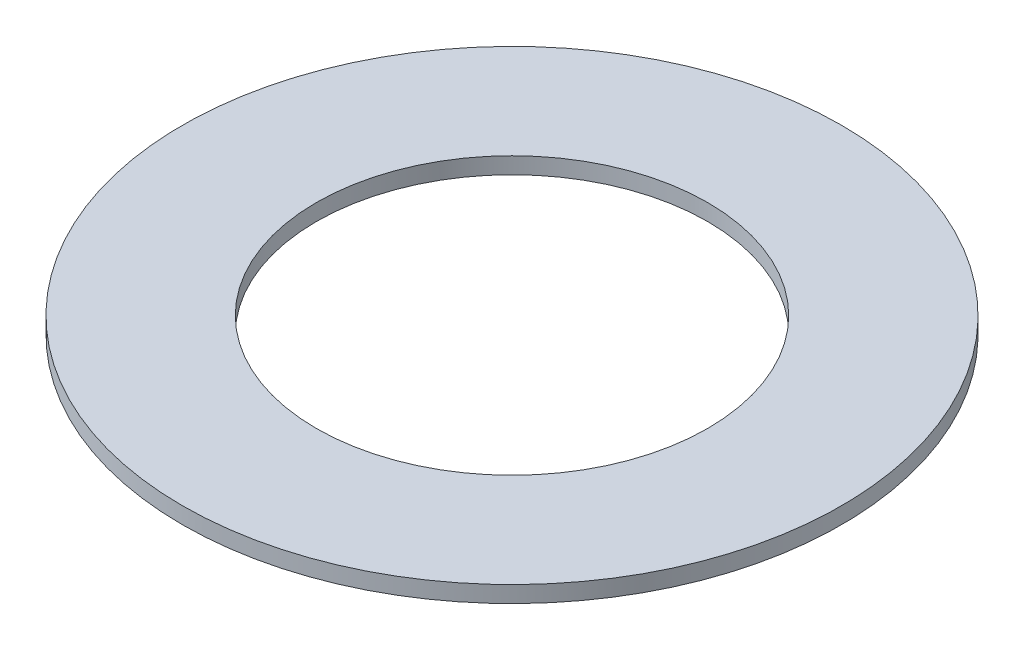
from build123d import *

# Parameters (mm, degrees)
SKETCH1_R           = 80
BOSS_EXTRUDE1_DEPTH = 4
SKETCH2_R           = 47.5
CUT_EXTRUDE1_DEPTH  = 114.207773585


with BuildPart() as part:
    # Sketch1 → Boss-Extrude1 (new body)
    with BuildSketch(Plane(origin=(0, 0, 0), x_dir=(1, 0, 0), z_dir=(0, 1, 0))):
        Circle(SKETCH1_R)
    extrude(amount=BOSS_EXTRUDE1_DEPTH)

    # Sketch2 → Cut-Extrude1 (cut, through all)
    with BuildSketch(Plane(origin=(0, 0, 0), x_dir=(1, 0, 0), z_dir=(0, 1, 0))):
        Circle(SKETCH2_R)
    extrude(amount=CUT_EXTRUDE1_DEPTH, mode=Mode.SUBTRACT)


solid = part.part
